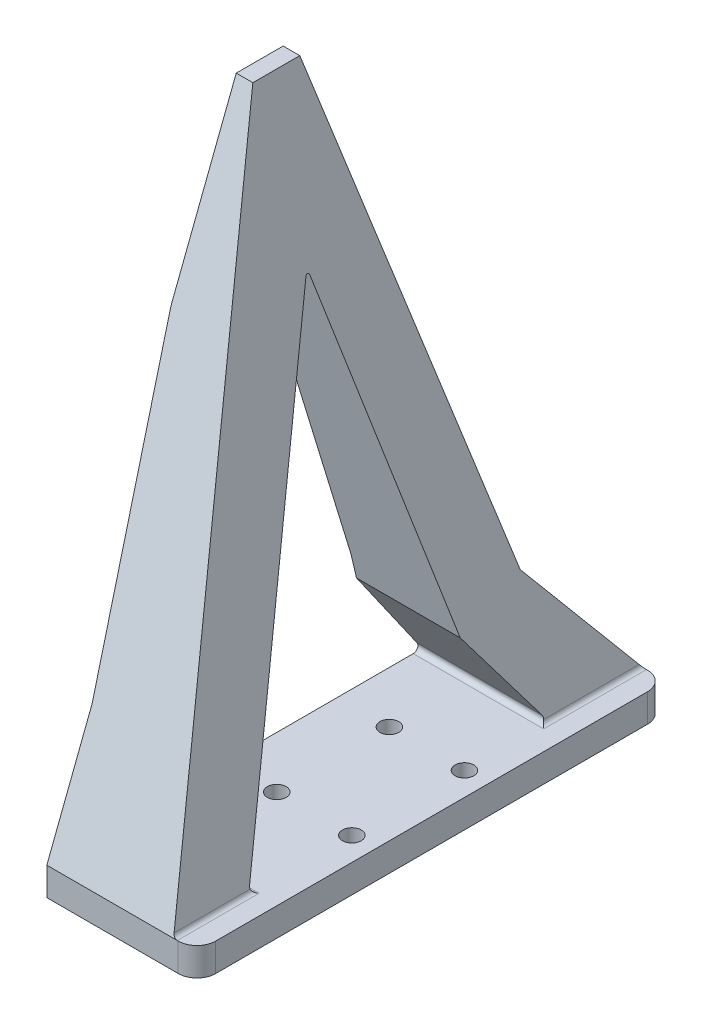
from build123d import *

# Parameters (mm, degrees)
SKETCH_1_R          = 1
EXTRUDE_1_DEPTH     = 3
SKETCH_2_W          = 16.007753667
SKETCH_2_H          = 50
EXTRUDE_2_DEPTH     = 80
CUT_EXTRUDE_1_DEPTH = 89.149011211
CUT_EXTRUDE_2_DEPTH = 81.960252593
EXTRUDE_3_DEPTH     = 3
CUT_EXTRUDE_3_DEPTH = 82.357621032
FILLET_1_R          = 0.5
FILLET_2_R          = 0.2


with BuildPart() as part:
    # 草图1 → 凸台-拉伸1 (new body)
    with BuildSketch(Plane(origin=(0, 0, 0), x_dir=(1, 0, 0), z_dir=(0, 1, 0))):
        with BuildLine():
            Line((-9.25, 25), (7.25, 25))
            ThreePointArc((7.25, 25), (8.664213562, 24.414213562), (9.25, 23))
            Line((9.25, 23), (9.25, -23))
            ThreePointArc((9.25, -23), (8.664213562, -24.414213562), (7.25, -25))
            Line((7.25, -25), (-9.25, -25))
            Line((-9.25, -25), (-9.25, 25))
        make_face()
        with Locations(Location((-1.25, 6, 0), (0, 0, 270))):
            Circle(SKETCH_1_R, mode=Mode.SUBTRACT)
        with Locations(Location((-1.25, -6, 0), (0, 0, 270))):
            Circle(SKETCH_1_R, mode=Mode.SUBTRACT)
        with Locations(Location((6.75, -6, 0), (0, 0, 270))):
            Circle(SKETCH_1_R, mode=Mode.SUBTRACT)
        with Locations(Location((6.75, 6, 0), (0, 0, 270))):
            Circle(SKETCH_1_R, mode=Mode.SUBTRACT)
    extrude(amount=EXTRUDE_1_DEPTH)

    # 草图2 → 凸台-拉伸2 (add)
    with BuildSketch(Plane(origin=(0, 3, 0), x_dir=(1, 0, 0), z_dir=(0, 1, 0))):
        with Locations((-1.246123166, 0)):
            Rectangle(SKETCH_2_W, SKETCH_2_H)
    extrude(amount=EXTRUDE_2_DEPTH)

    # 草图3 → 切除-拉伸1 (cut, through all)
    with BuildSketch(Plane(origin=(6.757753667, 0, 0), x_dir=(0, 0, -1), z_dir=(1, 0, 0))):
        Polygon((0, 47), (-17, 3), (15, 3), (8, 13), align=None)
        Polygon((25, 3), (15, 15.5), (3.181818182, 63), (-1.818181818, 63), (-25, 3), (-37.679958822, 3), (-37.679958822, 88.436899398), (63.328418147, 88.436899398), (63.328418147, 3), align=None)
    extrude(amount=-CUT_EXTRUDE_1_DEPTH, mode=Mode.SUBTRACT)

    # 草图4 → 切除-拉伸2 (cut, through all)
    with BuildSketch(Plane(origin=(0, 0, -25), x_dir=(-1, 0, 0), z_dir=(0, 0, -1))):
        Polygon((-6.757753667, 3), (8.40756476, 64.742116762), (-6.757753667, 64.742116762), align=None)
    extrude(amount=-CUT_EXTRUDE_2_DEPTH, mode=Mode.SUBTRACT)

    # 草图5 → 凸台-拉伸3 (add)
    with BuildSketch(Plane.ZY.offset(9.25)):
        Polygon((-3.181818182, 63), (-15, 15.5), (-25, 3), (-25, 0), (25, 0), (25, 3), (1.818181818, 63), align=None)
        Polygon((0, 47), (-8, 13), (-15, 3), (17, 3), align=None, mode=Mode.SUBTRACT)
    extrude(amount=EXTRUDE_3_DEPTH)

    # 草图6 → 切除-拉伸3 (cut, through all)
    with BuildSketch(Plane(origin=(0, 0, -25), x_dir=(-1, 0, 0), z_dir=(0, 0, -1))):
        Polygon((9.75, 65), (9.75, 45), (6.75, 15.5), (6.75, 0), (15.065136108, 0), (15.065136108, 65), align=None)
    extrude(amount=-CUT_EXTRUDE_3_DEPTH, mode=Mode.SUBTRACT)

    # 圆角1
    # the kernel refuses this fillet: 0.5 mm, written as the material it adds along each edge
    with BuildSketch(Plane(origin=(-6.75, 3, 17), x_dir=(0, 0, -1), z_dir=(1, 0, 0))) as fillet_1_piece_1_section:
        with BuildLine():
            CenterArc((FILLET_1_R * 1.45840694682, FILLET_1_R), FILLET_1_R, 158.875280854, 111.124719146)
            Line((FILLET_1_R * 0.525608812419, FILLET_1_R * 1.3603992792), (0, 0))
            Line((0, 0), (FILLET_1_R * 1.45840694682, 0))
        make_face()
    fillet_1_piece_1 = extrude(amount=15.33076235, mode=Mode.PRIVATE)
    fillet_1_piece_1 = split(fillet_1_piece_1, bisect_by=Plane(origin=(6.334852861, 4.721743663, 16.763347765), z_dir=(-0.9711342799096352, -0.23853345757858446, 0)), keep=Keep.TOP, mode=Mode.PRIVATE)
    add(fillet_1_piece_1)
    with BuildSketch(Plane(origin=(9.158573119, 3, -15), x_dir=(0, 0, 1), z_dir=(-1, 0, 0))) as fillet_1_piece_2_section:
        with BuildLine():
            CenterArc((FILLET_1_R * 1.92065556157, FILLET_1_R), FILLET_1_R, 145.007979801, 124.992020199)
            Line((FILLET_1_R * 1.10142364105, FILLET_1_R * 1.57346234436), (0, 0))
            Line((0, 0), (FILLET_1_R * 1.92065556157, 0))
        make_face()
    fillet_1_piece_2 = extrude(amount=15.908573119, mode=Mode.PRIVATE)
    fillet_1_piece_2 = split(fillet_1_piece_2, bisect_by=Plane(origin=(6.326718063, 4.754862629, -14.622728055), z_dir=(-0.9711342799096352, -0.23853345757858446, 0)), keep=Keep.TOP, mode=Mode.PRIVATE)
    add(fillet_1_piece_2)
    with BuildSketch(Plane(origin=(6.757753667, 3, 16.019874802), x_dir=(1, 0, 0), z_dir=(0, 0, 1))) as fillet_1_piece_3_section:
        with BuildLine():
            CenterArc((FILLET_1_R * 0.784100158108, FILLET_1_R), FILLET_1_R, 193.8, 76.2)
            Line((-FILLET_1_R * 0.187034121801, FILLET_1_R * 0.761466542421), (0, 0))
            Line((0, 0), (FILLET_1_R * 0.784100158108, 0))
        make_face()
    fillet_1_piece_3 = extrude(amount=8.980125198, mode=Mode.PRIVATE)
    fillet_1_piece_3 = split(fillet_1_piece_3, bisect_by=Plane(origin=(6.823760744, 4.428941995, 24.447908775), z_dir=(0, -0.3603992792021625, -0.9327981344055968)), keep=Keep.TOP, mode=Mode.PRIVATE)
    fillet_1_piece_3 = split(fillet_1_piece_3, bisect_by=Plane(origin=(6.823760744, 1.739503793, 17.487009898), z_dir=(0, 0.3603992792021626, 0.9327981344055968)), keep=Keep.TOP, mode=Mode.PRIVATE)
    add(fillet_1_piece_3)
    with BuildSketch(Plane(origin=(6.757753667, 3, -25), x_dir=(1, 0, 0), z_dir=(0, 0, 1))) as fillet_1_piece_4_section:
        with BuildLine():
            CenterArc((FILLET_1_R * 0.784100158108, FILLET_1_R), FILLET_1_R, 193.8, 76.2)
            Line((-FILLET_1_R * 0.187034121801, FILLET_1_R * 0.761466542421), (0, 0))
            Line((0, 0), (FILLET_1_R * 0.784100158108, 0))
        make_face()
    fillet_1_piece_4 = extrude(amount=10.980125198, mode=Mode.PRIVATE)
    fillet_1_piece_4 = split(fillet_1_piece_4, bisect_by=Plane(origin=(6.823819727, 5.521194882, -22.983044095), z_dir=(0, -0.6246950475544241, 0.7808688094430307)), keep=Keep.TOP, mode=Mode.PRIVATE)
    fillet_1_piece_4 = split(fillet_1_piece_4, bisect_by=Plane(origin=(6.823819727, 0.737200979, -16.583959315), z_dir=(0, 0.5734623443633279, -0.819231920519041)), keep=Keep.TOP, mode=Mode.PRIVATE)
    add(fillet_1_piece_4)
    with BuildSketch(Plane(origin=(-6.75, 3, 17), x_dir=(0, 0, -1), z_dir=(1, 0, 0))) as fillet_1_piece_5a_section:
        with BuildLine():
            CenterArc((FILLET_1_R * 1.45840694682, FILLET_1_R), FILLET_1_R, 158.875280854, 111.124719146)
            Line((FILLET_1_R * 0.525608812419, FILLET_1_R * 1.3603992792), (0, 0))
            Line((0, 0), (FILLET_1_R * 1.45840694682, 0))
        make_face()
    fillet_1_piece_5a = extrude(amount=15.33076235, mode=Mode.PRIVATE)
    fillet_1_piece_5a = split(fillet_1_piece_5a, bisect_by=Plane(origin=(6.770254608, 2.949105284, 16.764105763), z_dir=(0.9711342799096352, 0.23853345757858446, 0)), keep=Keep.TOP, mode=Mode.PRIVATE)
    with BuildSketch(Plane(origin=(6.757753667, 3, 16.019874802), x_dir=(1, 0, 0), z_dir=(0, 0, 1))) as fillet_1_piece_5b_section:
        with BuildLine():
            CenterArc((FILLET_1_R * 0.784100158108, FILLET_1_R), FILLET_1_R, 193.8, 76.2)
            Line((-FILLET_1_R * 0.187034121801, FILLET_1_R * 0.761466542421), (0, 0))
            Line((0, 0), (FILLET_1_R * 0.784100158108, 0))
        make_face()
    fillet_1_piece_5b = extrude(amount=8.980125198, mode=Mode.PRIVATE)
    fillet_1_piece_5b = split(fillet_1_piece_5b, bisect_by=Plane(origin=(6.826253209, 3.240744299, 16.906985157), z_dir=(0, -0.3603992792021626, -0.9327981344055968)), keep=Keep.TOP, mode=Mode.PRIVATE)
    fillet_1_piece_5 = fillet_1_piece_5a & fillet_1_piece_5b
    add(fillet_1_piece_5)
    with BuildSketch(Plane(origin=(6.757753667, 3, -25), x_dir=(1, 0, 0), z_dir=(0, 0, 1))) as fillet_1_piece_6a_section:
        with BuildLine():
            CenterArc((FILLET_1_R * 0.784100158108, FILLET_1_R), FILLET_1_R, 193.8, 76.2)
            Line((-FILLET_1_R * 0.187034121801, FILLET_1_R * 0.761466542421), (0, 0))
            Line((0, 0), (FILLET_1_R * 0.784100158108, 0))
        make_face()
    fillet_1_piece_6a = extrude(amount=10.980125198, mode=Mode.PRIVATE)
    fillet_1_piece_6a = split(fillet_1_piece_6a, bisect_by=Plane(origin=(6.828403151, 3.296038352, -14.792773154), z_dir=(0, -0.5734623443633279, 0.819231920519041)), keep=Keep.TOP, mode=Mode.PRIVATE)
    with BuildSketch(Plane(origin=(9.158573119, 3, -15), x_dir=(0, 0, 1), z_dir=(-1, 0, 0))) as fillet_1_piece_6b_section:
        with BuildLine():
            CenterArc((FILLET_1_R * 1.92065556157, FILLET_1_R), FILLET_1_R, 145.007979801, 124.992020199)
            Line((FILLET_1_R * 1.10142364105, FILLET_1_R * 1.57346234436), (0, 0))
            Line((0, 0), (FILLET_1_R * 1.92065556157, 0))
        make_face()
    fillet_1_piece_6b = extrude(amount=15.908573119, mode=Mode.PRIVATE)
    fillet_1_piece_6b = split(fillet_1_piece_6b, bisect_by=Plane(origin=(6.778509417, 2.915497721, -14.622764636), z_dir=(0.9711342799096352, 0.23853345757858446, 0)), keep=Keep.TOP, mode=Mode.PRIVATE)
    fillet_1_piece_6 = fillet_1_piece_6a & fillet_1_piece_6b
    add(fillet_1_piece_6)

    # 圆角2
    fillet_2_edges = [part.edges().sort_by_distance(p)[0] for p in [
        (-6.899841453, 47, 0),
    ]]
    fillet(fillet_2_edges, radius=FILLET_2_R)


solid = part.part
